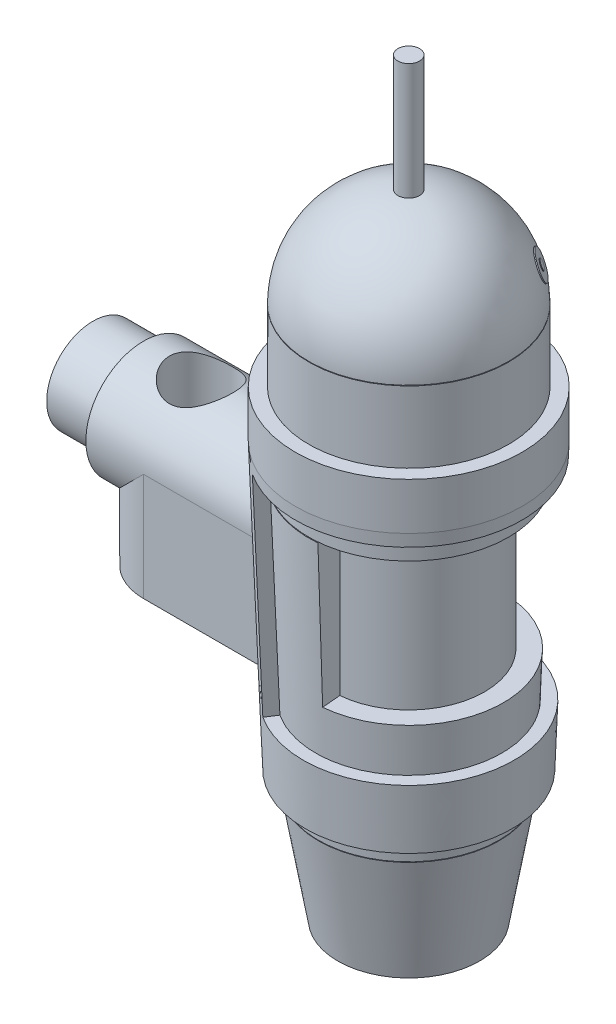
from build123d import *

# Parameters (mm, degrees)
CUT_REVOLVE1_ANGLE       = 170
SKETCH10_R               = 1.75
BOSS_EXTRUDE3_DEPTH      = 35
SKETCH15_R               = 1
BOSS_EXTRUDE4_DEPTH      = 4
FILLET2_R                = 1
CIRPATTERN1_COUNT        = 10
FILLET2_OF_CIRPATTERN1_R = 1
SKETCH4_W                = 13.4
SKETCH4_H                = 34.3
CUT_REVOLVE2_ANGLE       = 246
BOSS_EXTRUDE1_REACH      = 139.371
FILLET1_R                = 9.35
SKETCH7_R                = 5.15
CUT_EXTRUDE1_DEPTH       = 101.099001055
BOSS_EXTRUDE2_REACH      = 143.227
SKETCH9_R                = 7.5


with BuildPart() as part:
    # Sketch1 → Revolve1 (revolve)
    with BuildSketch(Plane.XY, mode=Mode.PRIVATE) as revolve1_sk:
        with BuildLine():
            Line((11.5, 0), (14.65, 18.5))
            Line((14.65, 18.5), (16.2, 61.8))
            Line((16.2, 61.8), (16.2, 86.5))
            ThreePointArc((16.2, 86.5), (11.455129855, 97.955129855), (0, 102.7))
            Line((0, 102.7), (0, 16.7))
            Line((0, 16.7), (6, 16.7))
            Line((6, 16.7), (6, 20))
            Line((6, 20), (10.5, 20))
            Line((10.5, 20), (10.5, 0))
            Line((10.5, 0), (11.5, 0))
        make_face()
    revolve(revolve1_sk.sketch.rotate(Axis((0, 0, 0), (0, -1, 0)), 90), axis=Axis((0, 0, 0), (0, -1, 0)))

    # Sketch2 → Cut-Revolve1 (revolve, symmetric, cut)
    with BuildSketch(Plane.XY) as cut_revolve1_sk:
        Polygon((16.2, 61.8), (15.355196305, 38.2), (12.3, 38.2), (12.3, 61.8), align=None)
    revolve(axis=Axis((0, 0, 0), (0, -1, 0)), revolution_arc=CUT_REVOLVE1_ANGLE / 2, mode=Mode.SUBTRACT)
    revolve(cut_revolve1_sk.sketch, axis=Axis((0, 0, 0), (0, 1, 0)), revolution_arc=CUT_REVOLVE1_ANGLE / 2, mode=Mode.SUBTRACT)

    # Sketch10 → Boss-Extrude3 (add)
    with BuildSketch(Plane(origin=(0, 86.5, 0), x_dir=(1, 0, 0), z_dir=(0, 1, 0))):
        with Locations(Location((0, 0, 0), (0, 0, 270))):
            Circle(SKETCH10_R)
    extrude(amount=BOSS_EXTRUDE3_DEPTH)

    # Sketch12 → Cut-Revolve3 (revolve, cut)
    with BuildSketch(Plane.XY):
        Polygon((5, 16.7), (1.2, 17.7), (1.2, 18.2), (0, 18.2), (0, 16.7), align=None)
    revolve(axis=Axis((0, 0, 0), (0, 1, 0)), mode=Mode.SUBTRACT)

    # Sketch14 → Cut-Revolve4 (revolve, cut)
    with BuildSketch(Plane.XY):
        Polygon((16.2, 61.866987298), (15.95, 61.8), (16.2, 61.733012702), align=None)
        Polygon((14.651577984, 18.544081745), (14.401577984, 18.5), (14.651577984, 18.455918255), align=None)
        Polygon((16.2, 86.455918255), (15.95, 86.5), (16.2, 86.544081745), align=None)
    revolve(axis=Axis((0, 16.7, 0), (0, 1, 0)), mode=Mode.SUBTRACT)

    # Sketch15 → Boss-Extrude4 (add)
    with BuildSketch(Plane.XZ.offset(-20)):
        with Locations(Location((-6.876644452, -4.996174644, 0), (0, 0, 90))):
            Circle(SKETCH15_R)
    boss_extrude4 = extrude(amount=BOSS_EXTRUDE4_DEPTH)

    # Fillet2
    fillet2_edges = [part.edges().sort_by_distance(p)[0] for p in [
        (-6.876644452, 16, -5.996174644),
    ]]
    fillet(fillet2_edges, radius=FILLET2_R)

    # CirPattern1: Boss-Extrude4 ×10 about axis, 2 skipped
    cirpattern1_axis = Axis((0, -23.883118438, 0), (0, 1, 0))
    add([boss_extrude4.rotate(cirpattern1_axis, i * 360 / CIRPATTERN1_COUNT) for i in range(1, CIRPATTERN1_COUNT) if i not in (1, 6)])

    # Fillet2 of CirPattern1
    fillet2_of_cirpattern1_edges = [part.edges().sort_by_distance(p)[0] for p in [
        (-7.827700968, 16, 4.68715765),
        (-3.577700968, 16, 8.392997383),
        (2.0388592, 16, 8.892997383),
        (6.876644452, 16, 5.996174644),
        (7.827700968, 16, -4.68715765),
        (3.577700968, 16, -8.392997383),
        (-2.0388592, 16, -8.892997383),
    ]]
    fillet(fillet2_of_cirpattern1_edges, radius=FILLET2_OF_CIRPATTERN1_R)

    # Sketch11 → Revolve3 (revolve)
    with BuildSketch(Plane(origin=(0, 0, 0), x_dir=(0.7071067811865488, 0, -0.7071067811865464), z_dir=(0.7071067811865464, 0, 0.7071067811865488)), mode=Mode.PRIVATE) as revolve3_sk:
        Polygon((15.052873158, 89.584397782), (15.992565779, 89.926417925), (15.496636571, 91.288972225), (15.590605833, 91.32317424), (15.316989719, 92.074928336), (15.223020457, 92.040726322), (14.283327836, 91.698706179), align=None)
    revolve(revolve3_sk.sketch.rotate(Axis((0, 86.5, 0), (0.6644630243886773, 0.34202014332566283, -0.6644630243886751)), 270), axis=Axis((0, 86.5, 0), (0.6644630243886773, 0.34202014332566283, -0.6644630243886751)))


with BuildPart() as body_2:
    # Sketch3 → Revolve2 (revolve)
    with BuildSketch(Plane.XY, mode=Mode.PRIVATE) as revolve2_sk:
        Polygon((16.75, 21.2), (18.4, 67.293548387), (18.4, 74.9), (16.2, 74.9), (16.2, 61.8), (14.74665127, 21.2), align=None)
    revolve(revolve2_sk.sketch.rotate(Axis((0, 0, 0), (0, 1, 0)), 90), axis=Axis((0, 0, 0), (0, 1, 0)))

    # Sketch4 → Cut-Revolve2 (revolve, symmetric, cut)
    with BuildSketch(Plane.XY) as cut_revolve2_sk:
        with Locations((11.7, 48.15)):
            Rectangle(SKETCH4_W, SKETCH4_H)
    revolve(axis=Axis((0, 16.7, 0), (0, 1, 0)), revolution_arc=CUT_REVOLVE2_ANGLE / 2, mode=Mode.SUBTRACT)
    revolve(cut_revolve2_sk.sketch, axis=Axis((0, 16.7, 0), (0, -1, 0)), revolution_arc=CUT_REVOLVE2_ANGLE / 2, mode=Mode.SUBTRACT)

    # Boss-Extrude1: up to this cone (the profile starts outside it)
    boss_extrude1_end = Plane(origin=(0, 45.484563, 0), z_dir=(0, 1, 0)) * Cone(11.981664987, 23.256952687, 314.980617674, mode=Mode.PRIVATE)
    # Sketch6 → Boss-Extrude1 (add, up to the surface)
    with BuildSketch(Plane(origin=(-43, 0, 0), x_dir=(0, 0, -1), z_dir=(1, 0, 0)), mode=Mode.PRIVATE) as boss_extrude1_sk1:
        with BuildLine():
            Line((9.35, 50.45), (9.35, 33))
            Line((9.35, 33), (-9.35, 33))
            Line((-9.35, 33), (-9.35, 50.45))
            ThreePointArc((-9.35, 50.45), (0, 59.8), (9.35, 50.45))
        make_face()
    boss_extrude1_tool1 = extrude(boss_extrude1_sk1.sketch, amount=BOSS_EXTRUDE1_REACH, mode=Mode.PRIVATE) - boss_extrude1_end
    add(boss_extrude1_tool1.solids().sort_by_distance((-43, 45.484563, 0))[0])

    # Fillet1
    # the kernel refuses this fillet: 9.35 mm, written as the material it takes off along each edge
    with BuildSketch(Plane(origin=(-43, 50.45, -9.35), x_dir=(1, 0, 0), z_dir=(0, -1, 0))) as fillet1_piece_1_section:
        with BuildLine():
            CenterArc((FILLET1_R, FILLET1_R), FILLET1_R, 180, 90)
            Line((0, FILLET1_R), (0, 0))
            Line((0, 0), (FILLET1_R, 0))
        make_face()
    fillet1_piece_1 = extrude(amount=40.825, mode=Mode.PRIVATE)
    fillet1_piece_1 = fillet1_piece_1 - Plane(origin=(-40.713611531, 50.45, 0), x_dir=(0, 0, 1), z_dir=(-1, 0, 0)) * Cylinder(9.35, 120, mode=Mode.PRIVATE)
    add(fillet1_piece_1, mode=Mode.SUBTRACT)
    with BuildSketch(Plane(origin=(-43, 9.625, 9.35), x_dir=(1, 0, 0), z_dir=(0, 1, 0))) as fillet1_piece_2_section:
        with BuildLine():
            CenterArc((FILLET1_R, FILLET1_R), FILLET1_R, 180, 90)
            Line((0, FILLET1_R), (0, 0))
            Line((0, 0), (FILLET1_R, 0))
        make_face()
    fillet1_piece_2 = extrude(amount=40.825, mode=Mode.PRIVATE)
    fillet1_piece_2 = fillet1_piece_2 - Plane(origin=(-40.713611532, 50.45, 0), x_dir=(0, 0, 1), z_dir=(-1, 0, 0)) * Cylinder(9.35, 120, mode=Mode.PRIVATE)
    add(fillet1_piece_2, mode=Mode.SUBTRACT)

    # Sketch7 → Cut-Extrude1 (cut, through all)
    with BuildSketch(Plane.XZ.offset(-33)):
        with Locations(Location((-33.65, 0, 0), (0, 0, 270))):
            Circle(SKETCH7_R)
    extrude(amount=-CUT_EXTRUDE1_DEPTH, mode=Mode.SUBTRACT)

    # Sketch9 → Boss-Extrude2 (add, up to next)
    with BuildSketch(Plane(origin=(-51.2, 0, 0), x_dir=(0, 0, -1), z_dir=(1, 0, 0)), mode=Mode.PRIVATE) as boss_extrude2_sk1:
        with Locations((0, 51)):
            Circle(SKETCH9_R)
    boss_extrude2_tool1 = extrude(boss_extrude2_sk1.sketch, amount=BOSS_EXTRUDE2_REACH, mode=Mode.PRIVATE) - body_2.part
    add(boss_extrude2_tool1.solids().sort_by_distance((-51.2, 51, 0))[0])


solid = Compound([part.part, body_2.part])
